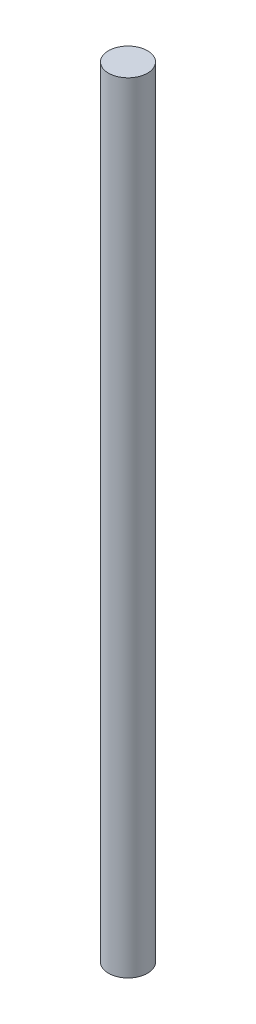
from build123d import *

# Parameters (mm, degrees)
SKETCH1_R           = 6.35
BOSS_EXTRUDE1_DEPTH = 254


with BuildPart() as part:
    # Sketch1 → Boss-Extrude1 (new body)
    with BuildSketch(Plane(origin=(0, 0, 0), x_dir=(1, 0, 0), z_dir=(0, 1, 0))):
        Circle(SKETCH1_R)
    extrude(amount=BOSS_EXTRUDE1_DEPTH)


solid = part.part
